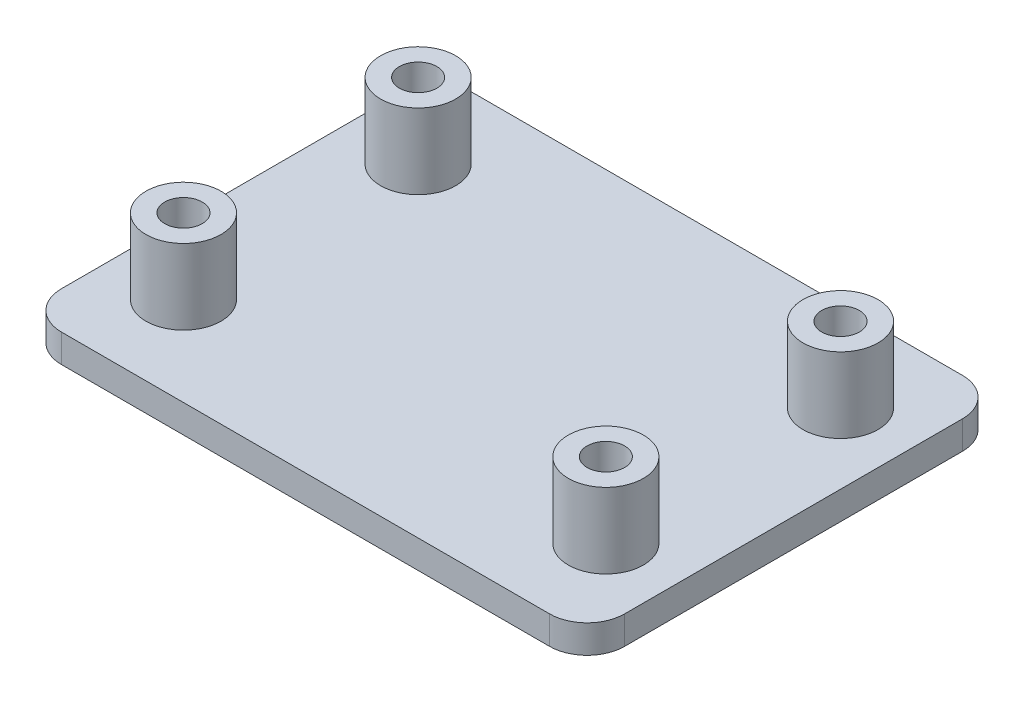
from build123d import *

# Parameters (mm, degrees)
BOSS_EXTRUDE1_DEPTH = 3
SKETCH2_R           = 4
BOSS_EXTRUDE2_DEPTH = 8
SKETCH3_R           = 2
CUT_EXTRUDE1_DEPTH  = 7


with BuildPart() as part:
    # Sketch1 → Boss-Extrude1 (new body)
    with BuildSketch(Plane(origin=(0, 0, 0), x_dir=(1, 0, 0), z_dir=(0, 1, 0))):
        with BuildLine():
            Line((-26, -22), (26, -22))
            ThreePointArc((26, -22), (28.828427125, -20.828427125), (30, -18))
            Line((30, -18), (30, 18))
            ThreePointArc((30, 18), (28.828427125, 20.828427125), (26, 22))
            Line((26, 22), (-26, 22))
            ThreePointArc((-26, 22), (-28.828427125, 20.828427125), (-30, 18))
            Line((-30, 18), (-30, -18))
            ThreePointArc((-30, -18), (-28.828427125, -20.828427125), (-26, -22))
        make_face()
    extrude(amount=BOSS_EXTRUDE1_DEPTH)

    # Sketch2 → Boss-Extrude2 (add)
    with BuildSketch(Plane(origin=(0, 3, 0), x_dir=(1, 0, 0), z_dir=(0, 1, 0))):
        with Locations((22.5, -12.5)):
            Circle(SKETCH2_R)
        with Locations((22.5, 12.5)):
            Circle(SKETCH2_R)
        with Locations((-22.5, -12.5)):
            Circle(SKETCH2_R)
        with Locations((-22.5, 12.5)):
            Circle(SKETCH2_R)
    extrude(amount=BOSS_EXTRUDE2_DEPTH)

    # Sketch3 → Cut-Extrude1 (cut)
    with BuildSketch(Plane(origin=(0, 11, 0), x_dir=(1, 0, 0), z_dir=(0, 1, 0))):
        with Locations((22.5, -12.5)):
            Circle(SKETCH3_R)
        with Locations((22.5, 12.5)):
            Circle(SKETCH3_R)
        with Locations((-22.5, -12.5)):
            Circle(SKETCH3_R)
        with Locations((-22.5, 12.5)):
            Circle(SKETCH3_R)
    extrude(amount=-CUT_EXTRUDE1_DEPTH, mode=Mode.SUBTRACT)


solid = part.part
